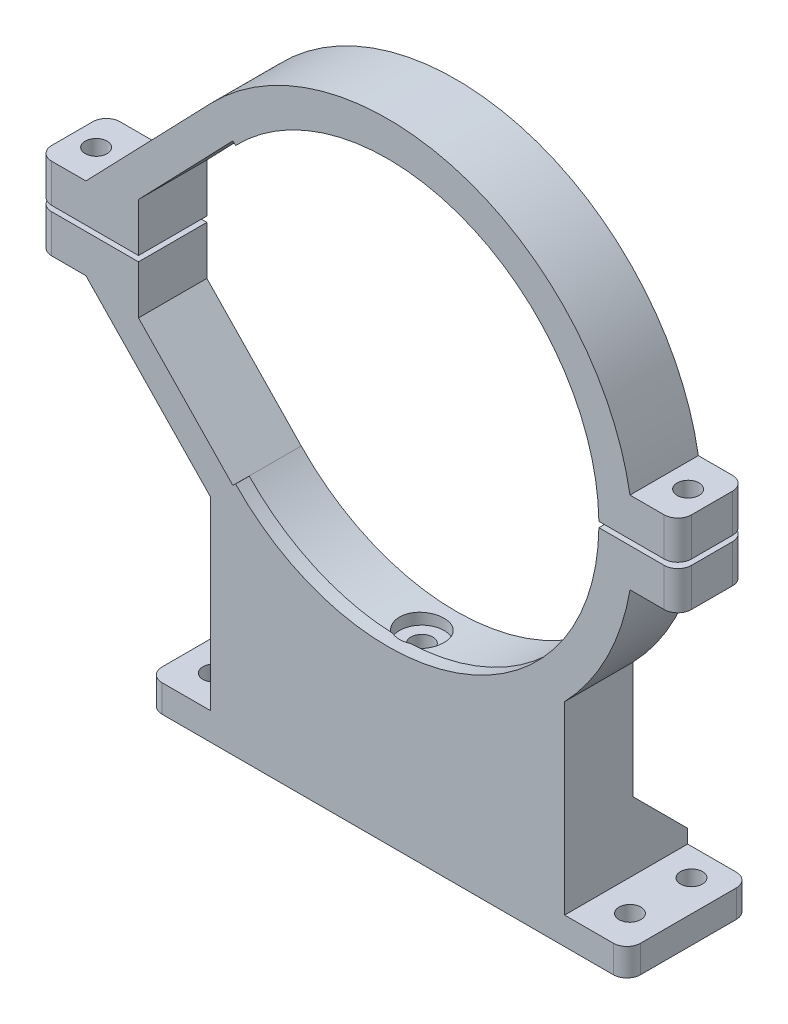
from build123d import *

# Parameters (mm, degrees)
BOSS_EXTRUDE1_DEPTH = 10
BOSS_EXTRUDE2_START = -2
BOSS_EXTRUDE2_DEPTH = 2
SKETCH3_W           = 112.571331904
SKETCH3_H           = 0.8
CUT_EXTRUDE1_DEPTH  = 77.489973678
SKETCH4_R           = 1.55
CUT_EXTRUDE2_DEPTH  = 10
SKETCH5_R           = 1.6
CUT_EXTRUDE3_DEPTH  = 81.985159587
FILLET1_R           = 2
FILLET2_R           = 2
SKETCH6_R           = 1.6
BOSS_EXTRUDE3_DEPTH = 4
FILLET3_R           = 2
CHAMFER1_SIZE       = 10
SKETCH7_R           = 1.6
CUT_EXTRUDE4_DEPTH  = 49
SKETCH8_R           = 3.25
CUT_EXTRUDE5_DEPTH  = 33


with BuildPart() as part:
    # Sketch1 → Boss-Extrude1 (new body)
    with BuildSketch(Plane.XY):
        with BuildLine():
            Line((42.445768436, 6), (35.445768436, 6))
            ThreePointArc((35.445768436, 6), (10.611085103, 34.348324165), (-25.885497938, 24.946813353))
            Line((-25.885497938, 24.946813353), (-44.145243897, 6))
            Line((-44.145243897, 6), (-51.145243897, 6))
            Line((-51.145243897, 6), (-51.145243897, -6))
            Line((-51.145243897, -6), (-44.145243897, -6))
            Line((-44.145243897, -6), (-25.885497938, -24.946813353))
            Line((-25.885497938, -24.946813353), (-25.885497938, -55.99))
            Line((-25.885497938, -55.99), (25.885497938, -55.99))
            Line((25.885497938, -55.99), (25.885497938, -24.946813353))
            ThreePointArc((25.885497938, -24.946813353), (32.095583697, -16.194937702), (35.445768436, -6))
            Line((35.445768436, -6), (42.445768436, -6))
            Line((42.445768436, -6), (42.445768436, 6))
        make_face()
        with BuildLine():
            ThreePointArc((-22.645310436, 21.824124617), (31.45, 0), (-22.645310436, -21.824124617))
            Line((-22.645310436, -21.824124617), (-36.45, -7.5))
            Line((-36.45, -7.5), (-36.45, 7.5))
            Line((-36.45, 7.5), (-22.645310436, 21.824124617))
        make_face(mode=Mode.SUBTRACT)
    extrude(amount=BOSS_EXTRUDE1_DEPTH)

    # Sketch2 → Boss-Extrude2 (add)
    with BuildSketch(Plane.XY.offset(10).offset(BOSS_EXTRUDE2_START)):
        with BuildLine():
            ThreePointArc((-22.645310436, -21.824124617), (31.45, 0), (-22.645310436, 21.824124617))
            Line((-22.645310436, 21.824124617), (-22.249287519, 21.44246266))
            ThreePointArc((-22.249287519, 21.44246266), (11.560861034, 28.655828241), (30.9, 0))
            ThreePointArc((30.9, 0), (11.560861034, -28.655828241), (-22.249287519, -21.44246266))
            Line((-22.249287519, -21.44246266), (-22.645310436, -21.824124617))
        make_face()
    extrude(amount=BOSS_EXTRUDE2_DEPTH)

    # Sketch3 → Cut-Extrude1 (cut, through all)
    with BuildSketch(Plane.XY.offset(10)):
        Rectangle(SKETCH3_W, SKETCH3_H)
    extrude(amount=-CUT_EXTRUDE1_DEPTH, mode=Mode.SUBTRACT)


with BuildPart() as cut_extrude1_piece_1:
    # of the separate pieces the step leaves, piece 1, a body of its own (cut_extrude1_pieces)
    add(part.part.solids().sort_by_distance((35.445768436, -6, 0))[0])

    # Sketch4 → Cut-Extrude2 (cut)
    with BuildSketch(Plane.XZ.offset(55.99)):
        with Locations(Location((-17.5, 5, 0), (0, 0, 270))):
            Circle(SKETCH4_R)
        with Locations(Location((17.5, 5, 0), (0, 0, 270))):
            Circle(SKETCH4_R)
    extrude(amount=-CUT_EXTRUDE2_DEPTH, mode=Mode.SUBTRACT)


with BuildPart() as cut_extrude1_piece_2:
    # of the separate pieces the step leaves, piece 2, a body of its own (cut_extrude1_pieces)
    add(part.part.solids().sort_by_distance((42.445768436, 0.4, 0))[0])


with BuildPart() as cut_extrude3_tool:
    # Sketch5 → Cut-Extrude3 (new, through all)
    with BuildSketch(Plane(origin=(0, 6, 0), x_dir=(1, 0, 0), z_dir=(0, 1, 0))):
        with Locations(Location((-47.645243897, -5, 0), (0, 0, 270))):
            Circle(SKETCH5_R)
        with Locations(Location((38.945768436, -5, 0), (0, 0, 270))):
            Circle(SKETCH5_R)
    extrude(amount=-CUT_EXTRUDE3_DEPTH)


with BuildPart() as cut_extrude1_piece_1_1:
    add(cut_extrude1_piece_1.part)

    # Cut-Extrude3: cut by cut_extrude3_tool
    add(cut_extrude3_tool.part, mode=Mode.SUBTRACT)

    # Fillet2
    fillet2_edges = [cut_extrude1_piece_1_1.edges().sort_by_distance(p)[0] for p in [
        (-51.145243897, -3.2, 0),
        (42.445768436, -3.2, 0),
        (-51.145243897, -3.2, 10),
        (42.445768436, -3.2, 10),
    ]]
    fillet(fillet2_edges, radius=FILLET2_R)

    # Sketch6 → Boss-Extrude3 (add)
    with BuildSketch(Plane.XZ.offset(55.99)):
        Polygon((35, -8), (35, 10), (25.885497938, 10), (25.885497938, 0), (-25.885497938, 0), (-25.885497938, 10), (-35, 10), (-35, -8), align=None)
        with Locations(Location((-30.442748969, 5, 0), (0, 0, 270))):
            Circle(SKETCH6_R, mode=Mode.SUBTRACT)
        with Locations(Location((30.442748969, -4, 0), (0, 0, 270))):
            Circle(SKETCH6_R, mode=Mode.SUBTRACT)
        with Locations(Location((30.442748969, 5, 0), (0, 0, 270))):
            Circle(SKETCH6_R, mode=Mode.SUBTRACT)
        with Locations(Location((-30.442748969, -4, 0), (0, 0, 270))):
            Circle(SKETCH6_R, mode=Mode.SUBTRACT)
    extrude(amount=-BOSS_EXTRUDE3_DEPTH)

    # Fillet3
    fillet3_edges = [cut_extrude1_piece_1_1.edges().sort_by_distance(p)[0] for p in [
        (35, -53.99, 10),
        (35, -53.99, -8),
        (-35, -53.99, -8),
        (-35, -53.99, 10),
    ]]
    fillet(fillet3_edges, radius=FILLET3_R)

    # Chamfer1
    # the kernel refuses this chamfer: 10 mm, written as the material it adds along each edge
    with BuildSketch(Plane(origin=(25.885497938, -51.99, 0), x_dir=(0, -0.027495876610586317, -0.9996219169112968), z_dir=(-1, 0, 0))) as chamfer1_piece_1_section:
        Polygon((CHAMFER1_SIZE * 0.999621916911, -CHAMFER1_SIZE * 0.0274958766106), (-CHAMFER1_SIZE * 0.0274958766106, -CHAMFER1_SIZE * 0.999621916911), (0, 0), align=None)
    chamfer1_piece_1 = extrude(amount=51.770995877, mode=Mode.PRIVATE)
    chamfer1_piece_1 = split(chamfer1_piece_1, bisect_by=Plane(origin=(0, -48.545555556, -8), z_dir=(0, 0, 1)), keep=Keep.TOP, mode=Mode.PRIVATE)
    add(chamfer1_piece_1)

    # Sketch7 → Cut-Extrude4 (cut)
    with BuildSketch(Plane.XZ.offset(55.99)):
        with Locations(Location((0, 5, 0), (0, 0, 270))):
            Circle(SKETCH7_R)
    extrude(amount=-CUT_EXTRUDE4_DEPTH, mode=Mode.SUBTRACT)

    # Sketch8 → Cut-Extrude5 (cut)
    with BuildSketch(Plane(origin=(0, 0, 0), x_dir=(1, 0, 0), z_dir=(0, 1, 0))):
        with Locations(Location((0, -5, 0), (0, 0, 270))):
            Circle(SKETCH8_R)
    extrude(amount=-CUT_EXTRUDE5_DEPTH, mode=Mode.SUBTRACT)


with BuildPart() as cut_extrude1_piece_2_1:
    add(cut_extrude1_piece_2.part)

    # Cut-Extrude3: cut by cut_extrude3_tool
    add(cut_extrude3_tool.part, mode=Mode.SUBTRACT)

    # Fillet1
    fillet1_edges = [cut_extrude1_piece_2_1.edges().sort_by_distance(p)[0] for p in [
        (-51.145243897, 3.2, 0),
        (-51.145243897, 3.2, 10),
        (42.445768436, 3.2, 0),
        (42.445768436, 3.2, 10),
    ]]
    fillet(fillet1_edges, radius=FILLET1_R)


solid = Compound([cut_extrude1_piece_1_1.part, cut_extrude1_piece_2_1.part])
